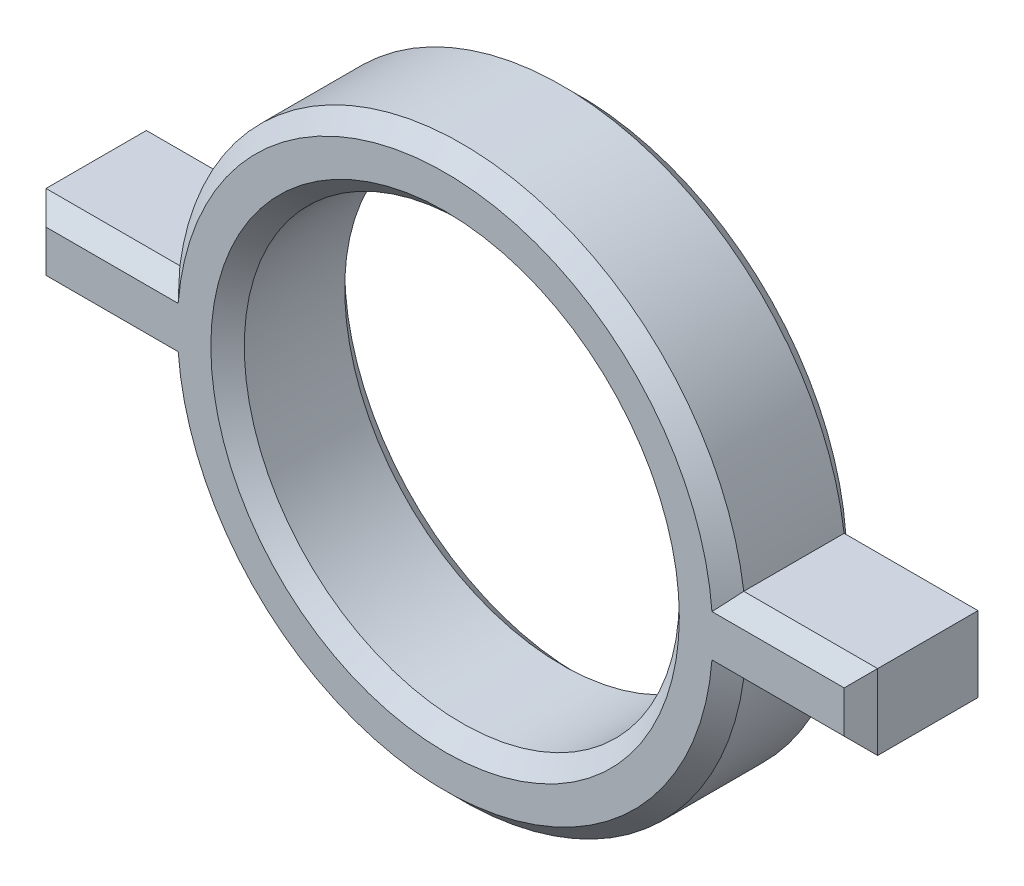
from build123d import *

# Parameters (mm, degrees)
SKETCH1_R           = 6.5
BOSS_EXTRUDE1_DEPTH = 4
CHAMFER1_SIZE       = 0.5


with BuildPart() as part:
    # Sketch1 → Boss-Extrude1 (new body)
    with BuildSketch(Plane.XY):
        with BuildLine():
            Line((8.425222549, -1.125), (12.425222549, -1.125))
            Line((12.425222549, -1.125), (12.425222549, 1.125))
            Line((12.425222549, 1.125), (8.425222549, 1.125))
            ThreePointArc((8.425222549, 1.125), (0, 8.5), (-8.425222549, 1.125))
            Line((-8.425222549, 1.125), (-12.425222549, 1.125))
            Line((-12.425222549, 1.125), (-12.425222549, -1.125))
            Line((-12.425222549, -1.125), (-8.425222549, -1.125))
            ThreePointArc((-8.425222549, -1.125), (0, -8.5), (8.425222549, -1.125))
        make_face()
        Circle(SKETCH1_R, mode=Mode.SUBTRACT)
    extrude(amount=BOSS_EXTRUDE1_DEPTH)

    # Chamfer1
    chamfer1_edges = [part.edges().sort_by_distance(p)[0] for p in [
        (-6.5, 0, 0),
        (-12.425222549, 0, 0),
        (-10.425222549, -1.125, 0),
        (0, -8.5, 0),
        (10.425222549, -1.125, 0),
        (12.425222549, 0, 0),
        (10.425222549, 1.125, 0),
        (0, 8.5, 0),
        (-10.425222549, 1.125, 0),
        (-6.5, 0, 4),
        (0, 8.5, 4),
        (10.425222549, 1.125, 4),
        (12.425222549, 0, 4),
        (10.425222549, -1.125, 4),
        (0, -8.5, 4),
        (-10.425222549, -1.125, 4),
        (-12.425222549, 0, 4),
        (-10.425222549, 1.125, 4),
    ]]
    chamfer(chamfer1_edges, length=CHAMFER1_SIZE)


solid = part.part
